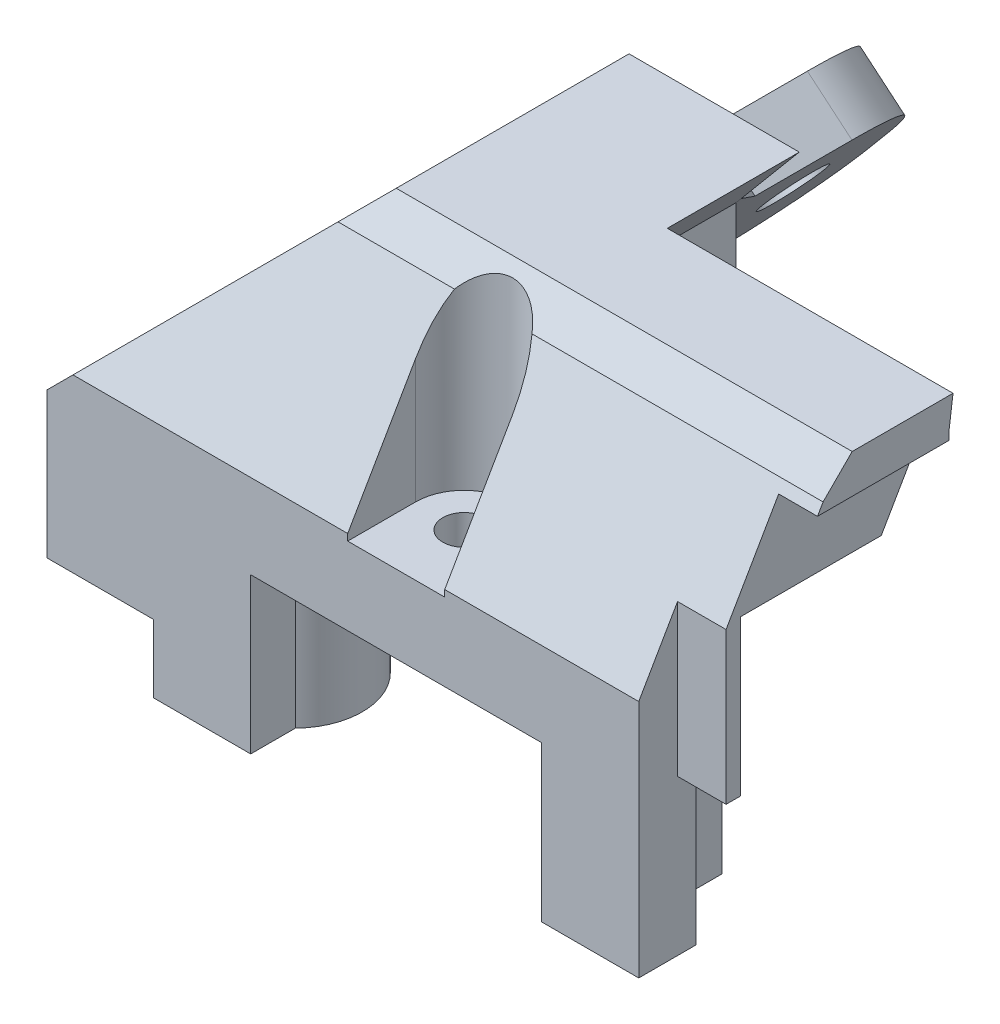
from build123d import *

# Parameters (mm, degrees)
SKETCH_1_W                      = 28
SKETCH_1_H                      = 11.5
SKETCH_1_R                      = 1.1
EXTRUDE_1_DEPTH                 = 3
SKETCH_2_R                      = 3.5
EXTRUDE_2_DEPTH                 = 8
CUT_EXTRUDE_1_DEPTH             = 22.260291625
CUT_EXTRUDE_1_DEPTH_BACK        = 22.260291625
SKETCH_3_W                      = 25.5
SKETCH_3_H                      = 3.95
EXTRUDE_3_DEPTH                 = 3
SKETCH_5_W                      = 3.5
SKETCH_5_H                      = 3
EXTRUDE_4_DEPTH                 = 2
EXTRUDE_5_DEPTH                 = 5
EXTRUDE_6_DEPTH                 = 5
SKETCH_8_W                      = 25.5
SKETCH_8_H                      = 3.95
EXTRUDE_7_DEPTH                 = 3
EXTRUDE_8_DEPTH                 = 4.5
SKETCH_10_W                     = 2.5
SKETCH_10_H                     = 17.5
EXTRUDE_9_DEPTH                 = 7
SKETCH_11_W                     = 25.5
SKETCH_11_H                     = 1.5
CUT_EXTRUDE_2_DEPTH             = 3
CHAMFER_1_SIZE                  = 1.5
CHAMFER_1_SIZE2                 = 2.598076211
EXTRUDE_10_REACH                = 31.245
EXTRUDE_10_DIRECTION_2_REACH    = 31.245
SKETCH_13_W                     = 3.5
SKETCH_13_H                     = 8
CUT_EXTRUDE_3_DEPTH             = 0.3
CHAMFER_2_SIZE                  = 0.75
SKETCH_14_W                     = 2.5
SKETCH_14_H                     = 2
CUT_EXTRUDE_4_DEPTH             = 30.244657632
CUT_EXTRUDE_4_DIRECTION_2_REACH = 31.245
CUT_EXTRUDE_5_REACH             = 29.663
SKETCH_15_W                     = 2.5
SKETCH_15_H                     = 8
SKETCH_16_R                     = 1.1
EXTRUDE_11_DEPTH                = 1
EXTRUDE_12_DEPTH                = 8.5
SKETCH_20_W                     = 7.5
SKETCH_20_H                     = 3
EXTRUDE_14_DEPTH                = 5.598076211
EXTRUDE_15_DEPTH                = 3
CUT_EXTRUDE_6_DEPTH             = 2
SKETCH_24_W                     = 2.5
SKETCH_24_H                     = 10.45
EXTRUDE_16_DEPTH                = 2
CUT_EXTRUDE_7_REACH             = 29.663
SKETCH_25_W                     = 13.241350553
SKETCH_25_H                     = 2
CHAMFER_3_SIZE                  = 1.5
CHAMFER_5_SIZE                  = 5
CHAMFER_5_SIZE2                 = 8.660254038
CHAMFER_6_SIZE                  = 10
CHAMFER_7_SIZE                  = 2
CHAMFER_8_SIZE                  = 2
EXTRUDE_17_DEPTH                = 1.5
EXTRUDE_21_DEPTH                = 2
EXTRUDE_18_DEPTH                = 2
CHAMFER_9_SIZE                  = 1.5
EXTRUDE_19_DEPTH                = 15.984546635
EXTRUDE_20_REACH                = 31.606
CUT_EXTRUDE_8_REACH             = 31.606
EXTRUDE_22_DEPTH                = 12
SKETCH_36_R                     = 1.6
CUT_EXTRUDE_9_DEPTH             = 3
EXTRUDE_23_DEPTH                = 10
FILLET_1_R                      = 5


# Some blends are built 0.0001 mm under size
with BuildPart() as part:
    # 草图1 → 凸台-拉伸1 (new body)
    with BuildSketch(Plane(origin=(0, 0, 0), x_dir=(1, 0, 0), z_dir=(0, 1, 0))):
        with Locations((-4, 2.25)):
            Rectangle(SKETCH_1_W, SKETCH_1_H)
        with Locations(Location((0, 0, 0), (0, 0, 270))):
            Circle(SKETCH_1_R, mode=Mode.SUBTRACT)
    extrude(amount=EXTRUDE_1_DEPTH)

    # 草图2 → 凸台-拉伸2 (add)
    with BuildSketch(Plane.XZ):
        with Locations(Location((-10, -1.25, 0), (0, 0, 90))):
            Circle(SKETCH_2_R)
        with BuildLine():
            Line((10, 2.25), (10, -4.75))
            ThreePointArc((10, -4.75), (6.5, -1.25), (10, 2.25))
        make_face()
    extrude(amount=EXTRUDE_2_DEPTH)

    # 草图3 → 切除-拉伸1 (cut, two sides: drawn at the far end of the back side and taken through both)
    with BuildSketch(Plane.XZ.offset(-CUT_EXTRUDE_1_DEPTH_BACK)):
        with Locations((-2.75, -6.025)):
            Rectangle(SKETCH_3_W, SKETCH_3_H)
    extrude(amount=CUT_EXTRUDE_1_DEPTH + CUT_EXTRUDE_1_DEPTH_BACK, mode=Mode.SUBTRACT)

    # 草图4 → 凸台-拉伸3 (add)
    with BuildSketch(Plane(origin=(10, 0, 0), x_dir=(0, 0, -1), z_dir=(1, 0, 0))):
        Polygon((0, 3), (0, -8), (-2.25, -8), (-2.25, 0), (-3.5, 0), (-3.5, 3), align=None)
    extrude(amount=EXTRUDE_3_DEPTH)

    # 草图5 → 凸台-拉伸4 (add)
    with BuildSketch(Plane(origin=(13, 0, 0), x_dir=(0, 0, -1), z_dir=(1, 0, 0))):
        with Locations((-1.75, 1.5)):
            Rectangle(SKETCH_5_W, SKETCH_5_H)
    extrude(amount=EXTRUDE_4_DEPTH)

    # 草图6 → 凸台-拉伸5 (add)
    with BuildSketch(Plane(origin=(0, 3, 0), x_dir=(1, 0, 0), z_dir=(0, 1, 0))):
        with BuildLine():
            Line((-2.5, 0), (-2.5, -3.5))
            Line((-2.5, -3.5), (-18, -3.5))
            Line((-18, -3.5), (-18, 8))
            Line((-18, 8), (-15.5, 8))
            Line((-15.5, 8), (-15.5, 4.05))
            Line((-15.5, 4.05), (10, 4.05))
            Line((10, 4.05), (10, 0))
            Line((10, 0), (15, 0))
            Line((15, 0), (15, -3.5))
            Line((15, -3.5), (2.5, -3.5))
            Line((2.5, -3.5), (2.5, 0))
            ThreePointArc((2.5, 0), (0, 2.5), (-2.5, 0))
        make_face()
    extrude(amount=EXTRUDE_5_DEPTH)

    # 草图7 → 凸台-拉伸6 (add)
    with BuildSketch(Plane(origin=(0, 8, 0), x_dir=(1, 0, 0), z_dir=(0, 1, 0))):
        with BuildLine():
            Line((10, 0), (10, 4.05))
            Line((10, 4.05), (-15.5, 4.05))
            Line((-15.5, 4.05), (-15.5, 8))
            Line((-15.5, 8), (-18, 8))
            Line((-18, 8), (-18, -3.5))
            Line((-18, -3.5), (-2.5, -3.5))
            Line((-2.5, -3.5), (-2.5, 0))
            ThreePointArc((-2.5, 0), (0, 2.5), (2.5, 0))
            Line((2.5, 0), (2.5, -3.5))
            Line((2.5, -3.5), (15, -3.5))
            Line((15, -3.5), (15, 0))
            Line((15, 0), (10, 0))
        make_face()
        Polygon((10, 0), (15, 0), (15, 8), (-15.5, 8), (-15.5, 4.05), (10, 4.05), align=None)
    extrude(amount=EXTRUDE_6_DEPTH)

    # 草图8 → 凸台-拉伸7 (add)
    with BuildSketch(Plane.XZ.offset(-8)):
        with Locations((-2.75, -6.025)):
            Rectangle(SKETCH_8_W, SKETCH_8_H)
    extrude(amount=EXTRUDE_7_DEPTH)

    # 草图9 → 凸台-拉伸8 (add)
    with BuildSketch(Plane.XZ):
        with BuildLine():
            Line((-12.1, -4.05), (-15.5, -4.05))
            Line((-15.5, -4.05), (-15.5, -8))
            Line((-15.5, -8), (-18, -8))
            Line((-18, -8), (-18, -4.05))
            Line((-18, -4.05), (-18, 3.5))
            Line((-18, 3.5), (-7.5, 3.5))
            Line((-7.5, 3.5), (-7.5, 1.199489743))
            ThreePointArc((-7.5, 1.199489743), (-12.632353631, 1.056667371), (-12.1, -4.05))
        make_face()
    extrude(amount=EXTRUDE_8_DEPTH)

    # 草图10 → 凸台-拉伸9 (add)
    with BuildSketch(Plane(origin=(0, 0, -8), x_dir=(-1, 0, 0), z_dir=(0, 0, -1))):
        with Locations((16.75, 4.25)):
            Rectangle(SKETCH_10_W, SKETCH_10_H)
    extrude(amount=EXTRUDE_9_DEPTH)

    # 草图11 → 切除-拉伸2 (cut)
    with BuildSketch(Plane.XZ.offset(-5)):
        with Locations((-2.75, -7.25)):
            Rectangle(SKETCH_11_W, SKETCH_11_H)
    extrude(amount=-CUT_EXTRUDE_2_DEPTH, mode=Mode.SUBTRACT)

    # 倒角1
    chamfer_1_edges = [part.edges().sort_by_distance(p)[0] for p in [
        (-0.25, 8, -8),
    ]]
    chamfer_1_side = [part.faces().sort_by_distance(p)[0] for p in [
        (-15.184682699, 8, -7.25),
    ]]
    chamfer(chamfer_1_edges, length=CHAMFER_1_SIZE, length2=CHAMFER_1_SIZE2, reference=chamfer_1_side[0])

    # 凸台-拉伸10: up to this face of the body (flat: up to its plane)
    extrude_10_end = Plane(part.part.faces().sort_by_distance((-10, -8, -1.080764101))[0])
    # 草图12 → 凸台-拉伸10 (add, up to the picked face)
    with BuildSketch(Plane.XZ.offset(4.5), mode=Mode.PRIVATE) as extrude_10_sk1:
        with BuildLine():
            Line((-12.5, 3.5), (-12.5, 1.199489743))
            ThreePointArc((-12.5, 1.199489743), (-10, 2.25), (-7.5, 1.199489743))
            Line((-7.5, 1.199489743), (-7.5, 3.5))
            Line((-7.5, 3.5), (-12.5, 3.5))
        make_face()
    extrude_10_tool1 = split(extrude(extrude_10_sk1.sketch, amount=EXTRUDE_10_REACH, mode=Mode.PRIVATE), bisect_by=extrude_10_end, keep=Keep.BOTH, mode=Mode.PRIVATE)
    # 草图12 → 凸台-拉伸10 (add, up to the picked face)
    with BuildSketch(Plane.XZ.offset(4.5), mode=Mode.PRIVATE) as extrude_10_sk2:
        with BuildLine():
            Line((7.5, 3.5), (7.5, 1.199489743))
            ThreePointArc((7.5, 1.199489743), (8.644126499, 1.976702194), (10, 2.25))
            Line((10, 2.25), (12.5, 2.25))
            Line((12.5, 2.25), (13, 2.25))
            Line((13, 2.25), (13, 3.5))
            Line((13, 3.5), (12.5, 3.5))
            Line((12.5, 3.5), (7.5, 3.5))
        make_face()
    extrude_10_tool2 = split(extrude(extrude_10_sk2.sketch, amount=EXTRUDE_10_REACH, mode=Mode.PRIVATE), bisect_by=extrude_10_end, keep=Keep.BOTH, mode=Mode.PRIVATE)
    add(extrude_10_tool1.solids().sort_by(Axis((-10, -4.5, 2.682619), (0, -1, 0)))[0])
    add(extrude_10_tool2.solids().sort_by(Axis((10.022618, -4.5, 2.776432), (0, -1, 0)))[0])

    # 凸台-拉伸10 direction 2: up to this face of the body (flat: up to its plane)
    extrude_10_direction_2_end = Plane(part.part.faces().sort_by_distance((1.489654817, 0, 0.088188875))[0])
    # 草图12 → 凸台-拉伸10 direction 2 (add, up to the picked face)
    with BuildSketch(Plane.XZ.offset(4.5), mode=Mode.PRIVATE) as extrude_10_direction_2_sk1:
        with BuildLine():
            Line((-12.5, 3.5), (-12.5, 1.199489743))
            ThreePointArc((-12.5, 1.199489743), (-10, 2.25), (-7.5, 1.199489743))
            Line((-7.5, 1.199489743), (-7.5, 3.5))
            Line((-7.5, 3.5), (-12.5, 3.5))
        make_face()
    extrude_10_direction_2_tool1 = split(extrude(extrude_10_direction_2_sk1.sketch, amount=-EXTRUDE_10_DIRECTION_2_REACH, mode=Mode.PRIVATE), bisect_by=extrude_10_direction_2_end, keep=Keep.BOTH, mode=Mode.PRIVATE)
    # 草图12 → 凸台-拉伸10 direction 2 (add, up to the picked face)
    with BuildSketch(Plane.XZ.offset(4.5), mode=Mode.PRIVATE) as extrude_10_direction_2_sk2:
        with BuildLine():
            Line((7.5, 3.5), (7.5, 1.199489743))
            ThreePointArc((7.5, 1.199489743), (8.644126499, 1.976702194), (10, 2.25))
            Line((10, 2.25), (12.5, 2.25))
            Line((12.5, 2.25), (13, 2.25))
            Line((13, 2.25), (13, 3.5))
            Line((13, 3.5), (12.5, 3.5))
            Line((12.5, 3.5), (7.5, 3.5))
        make_face()
    extrude_10_direction_2_tool2 = split(extrude(extrude_10_direction_2_sk2.sketch, amount=-EXTRUDE_10_DIRECTION_2_REACH, mode=Mode.PRIVATE), bisect_by=extrude_10_direction_2_end, keep=Keep.BOTH, mode=Mode.PRIVATE)
    add(extrude_10_direction_2_tool1.solids().sort_by(Axis((-10, -4.5, 2.682619), (0, 1, 0)))[0])
    add(extrude_10_direction_2_tool2.solids().sort_by(Axis((10.022618, -4.5, 2.776432), (0, 1, 0)))[0])

    # 草图13 → 切除-拉伸3 (cut)
    with BuildSketch(Plane(origin=(13, 0, 0), x_dir=(0, 0, -1), z_dir=(1, 0, 0))):
        with Locations((-1.75, -4)):
            Rectangle(SKETCH_13_W, SKETCH_13_H)
    extrude(amount=-CUT_EXTRUDE_3_DEPTH, mode=Mode.SUBTRACT)

    # 倒角2
    chamfer_2_edges = [part.edges().sort_by_distance(p)[0] for p in [
        (10, -1.5, -4.05),
        (10, 6.5, -6.5),
        (12.7, -4, 0),
        (15, 4, 0),
    ]]
    chamfer(chamfer_2_edges, length=CHAMFER_2_SIZE)

    # 草图14 → 切除-拉伸4 (cut)
    with BuildSketch(Plane.XZ.offset(4.5)):
        with Locations((13.75, 2.5)):
            Rectangle(SKETCH_14_W, SKETCH_14_H)
    extrude(amount=-CUT_EXTRUDE_4_DEPTH, mode=Mode.SUBTRACT)

    # 草图14 → 切除-拉伸4 direction 2 (cut, up to next)
    with BuildSketch(Plane.XZ.offset(4.5), mode=Mode.PRIVATE) as cut_extrude_4_direction_2_sk1:
        with Locations((13.75, 2.5)):
            Rectangle(SKETCH_14_W, SKETCH_14_H)
    cut_extrude_4_direction_2_tool1 = extrude(cut_extrude_4_direction_2_sk1.sketch, amount=CUT_EXTRUDE_4_DIRECTION_2_REACH, mode=Mode.PRIVATE) & part.part
    add(cut_extrude_4_direction_2_tool1.solids().sort_by_distance((13.75, -4.5, 2.5))[0], mode=Mode.SUBTRACT)

    # 草图15 → 切除-拉伸5 (cut, up to next)
    with BuildSketch(Plane.XY.offset(1.5), mode=Mode.PRIVATE) as cut_extrude_5_sk1:
        with Locations((13.75, -4)):
            Rectangle(SKETCH_15_W, SKETCH_15_H)
    cut_extrude_5_tool1 = extrude(cut_extrude_5_sk1.sketch, amount=-CUT_EXTRUDE_5_REACH, mode=Mode.PRIVATE) & part.part
    add(cut_extrude_5_tool1.solids().sort_by_distance((13.75, -4, 1.5))[0], mode=Mode.SUBTRACT)

    # 草图16 → 凸台-拉伸11 (add)
    with BuildSketch(Plane(origin=(0, 3, 0), x_dir=(1, 0, 0), z_dir=(0, 1, 0))):
        with BuildLine():
            Line((2.5, -3.5), (2.5, 0))
            ThreePointArc((2.5, 0), (0, 2.5), (-2.5, 0))
            Line((-2.5, 0), (-2.5, -3.5))
            Line((-2.5, -3.5), (2.5, -3.5))
        make_face()
        with Locations(Location((0, 0, 0), (0, 0, 270))):
            Circle(SKETCH_16_R, mode=Mode.SUBTRACT)
    extrude(amount=EXTRUDE_11_DEPTH)

    # 草图18 → 凸台-拉伸12 (add)
    with BuildSketch(Plane(origin=(0, 0, -6.5), x_dir=(-1, 0, 0), z_dir=(0, 0, -1))):
        Polygon((15.5, 5), (8.5, 5), (8.5, 10.598076211), (1, 10.598076211), (-1.015453365, 13), (1, 13), (15.5, 13), align=None)
    extrude(amount=EXTRUDE_12_DEPTH)

    # 草图20 → 凸台-拉伸14 (add)
    with BuildSketch(Plane.XZ.offset(-10.598076211)):
        with Locations((-4.75, -13.5)):
            Rectangle(SKETCH_20_W, SKETCH_20_H)
    extrude(amount=EXTRUDE_14_DEPTH)

    # 草图21 → 凸台-拉伸15 (add)
    with BuildSketch(Plane.XY.offset(-12)):
        Polygon((-1, 5), (-3.936848709, 1.5), (-8.5, 1.5), (-10.38797417, -0.75), (-15.5, -0.75), (-15.5, 1.5), (-15.5, 5), align=None)
    extrude(amount=-EXTRUDE_15_DEPTH)

    # 草图23 → 切除-拉伸6 (cut)
    with BuildSketch(Plane(origin=(0, 0, -15), x_dir=(-1, 0, 0), z_dir=(0, 0, -1))):
        Polygon((8.5, 1.5), (15.5, 1.5), (15.5, -0.75), (10.38797417, -0.75), align=None)
    extrude(amount=-CUT_EXTRUDE_6_DEPTH, mode=Mode.SUBTRACT)

    # 草图24 → 凸台-拉伸16 (add)
    with BuildSketch(Plane.XZ.offset(4.5)):
        with Locations((-16.75, -9.775)):
            Rectangle(SKETCH_24_W, SKETCH_24_H)
    extrude(amount=EXTRUDE_16_DEPTH)

    # 草图25 → 切除-拉伸7 (cut, up to next)
    with BuildSketch(Plane(origin=(0, 0, -13), x_dir=(-1, 0, 0), z_dir=(0, 0, -1)), mode=Mode.PRIVATE) as cut_extrude_7_sk1:
        with Locations((8.879324724, 2.5)):
            Rectangle(SKETCH_25_W, SKETCH_25_H)
    cut_extrude_7_tool1 = extrude(cut_extrude_7_sk1.sketch, amount=CUT_EXTRUDE_7_REACH, mode=Mode.PRIVATE) & part.part
    add(cut_extrude_7_tool1.solids().sort_by_distance((-8.879325, 2.5, -13))[0], mode=Mode.SUBTRACT)

    # 倒角3
    chamfer_3_edges = [part.edges().sort_by_distance(p)[0] for p in [
        (-4.75, 10.598076211, -12),
    ]]
    chamfer(chamfer_3_edges, length=CHAMFER_3_SIZE)

    # 倒角5
    chamfer_5_edges = [part.edges().sort_by_distance(p)[0] for p in [
        (-10.25, 13, 3.5),
        (7.5, 13, 3.5),
    ]]
    chamfer_5_side = [part.faces().sort_by_distance(p)[0] for p in [
        (-3.681918062, 13, -5.033050498),
    ]]
    chamfer(chamfer_5_edges, length=CHAMFER_5_SIZE, length2=CHAMFER_5_SIZE2, reference=chamfer_5_side[0])

    # 倒角6
    chamfer_6_edges = [part.edges().sort_by_distance(p)[0] for p in [
        (-18, 13, -8.25),
    ]]
    chamfer(chamfer_6_edges, length=CHAMFER_6_SIZE)

    # 倒角7
    chamfer_7_edges = [part.edges().sort_by_distance(p)[0] for p in [
        (-15.5, 3.5, -14),
    ]]
    chamfer(chamfer_7_edges, length=CHAMFER_7_SIZE)

    # 倒角8
    chamfer_8_edges = [part.edges().sort_by_distance(p)[0] for p in [
        (-15.5, 5, -8.025),
        (-8.5, 10.598076211, -9.25),
    ]]
    chamfer(chamfer_8_edges, length=CHAMFER_8_SIZE)

    # 草图28 → 凸台-拉伸17 (add)
    with BuildSketch(Plane(origin=(0, 13, 0), x_dir=(1, 0, 0), z_dir=(0, 1, 0))):
        with BuildLine():
            Line((1.015453365, 15), (-8, 15))
            Line((-8, 15), (-8, 1.5))
            Line((-8, 1.5), (-2, 1.5))
            ThreePointArc((-2, 1.5), (0, 2.5), (2, 1.5))
            Line((2, 1.5), (15, 1.5))
            Line((15, 1.5), (15, 8))
            Line((15, 8), (1.015453365, 8))
            Line((1.015453365, 8), (1.015453365, 15))
        make_face()
    extrude(amount=EXTRUDE_17_DEPTH)

    # 草图34 → 凸台-拉伸21 (add)
    with BuildSketch(Plane(origin=(0, 0, -13), x_dir=(-1, 0, 0), z_dir=(0, 0, -1))):
        Polygon((2.258649447, 3.5), (3.097749078, 2.5), (14.5, 2.5), (13.5, 3.5), align=None)
    extrude(amount=EXTRUDE_21_DEPTH)

    # 草图29 → 凸台-拉伸18 (add)
    with BuildSketch(Plane(origin=(15, 0, 0), x_dir=(0, 0, -1), z_dir=(1, 0, 0))):
        Polygon((1.5, 14.5), (1.5, 13), (1.211324865, 12.5), (8, 12.5), (8, 14.5), align=None)
    extrude(amount=EXTRUDE_18_DEPTH)

    # 倒角9
    chamfer_9_edges = [part.edges().sort_by_distance(p)[0] for p in [
        (-5, 14.5, -1.5),
        (-8, 14.5, -8.25),
    ]]
    chamfer(chamfer_9_edges, length=CHAMFER_9_SIZE - 0.0001)  # a hair under: the kernel refuses the full size

    # 草图30 → 凸台-拉伸19 (add)
    with BuildSketch(Plane(origin=(1.015453365, 0, 0), x_dir=(0, 0, -1), z_dir=(1, 0, 0))):
        Polygon((8, 13), (8.197478746, 14.5), (8, 14.5), align=None)
    extrude(amount=EXTRUDE_19_DEPTH)

    # 凸台-拉伸20: up to this face of the body (flat: up to its plane)
    extrude_20_end = Plane(part.part.faces().sort_by_distance((9.007726683, 13.75, -8.098739373))[0])
    # 草图32 → 凸台-拉伸20 (add, up to the picked face)
    with BuildSketch(Plane(origin=(0, 0, -15), x_dir=(-1, 0, 0), z_dir=(0, 0, -1)), mode=Mode.PRIVATE) as extrude_20_sk1:
        Polygon((-1.015453365, 13), (-2.274102812, 14.5), (-1.015453365, 14.5), align=None)
    extrude_20_tool1 = split(extrude(extrude_20_sk1.sketch, amount=-EXTRUDE_20_REACH, mode=Mode.PRIVATE), bisect_by=extrude_20_end, keep=Keep.BOTH, mode=Mode.PRIVATE)
    add(extrude_20_tool1.solids().sort_by(Axis((1.435003, 14, -15), (0, 0, 1)))[0])

    # 切除-拉伸8: up to this face of the body (flat: up to its plane)
    cut_extrude_8_end = Plane(part.part.faces().sort_by_distance((-7.893394404, 4.143694153, -12))[0])
    # 草图33 → 切除-拉伸8 (cut, up to the picked face)
    with BuildSketch(Plane(origin=(0, 0, -15), x_dir=(-1, 0, 0), z_dir=(0, 0, -1)), mode=Mode.PRIVATE) as cut_extrude_8_sk1:
        Polygon((1, 5), (1, 5.777861913), (4.589552354, 1.5), (3.936848709, 1.5), align=None)
    cut_extrude_8_tool1 = split(extrude(cut_extrude_8_sk1.sketch, amount=-CUT_EXTRUDE_8_REACH, mode=Mode.PRIVATE), bisect_by=cut_extrude_8_end, keep=Keep.BOTH, mode=Mode.PRIVATE)
    add(cut_extrude_8_tool1.solids().sort_by(Axis((-2.63704, 3.450948, -15), (0, 0, 1)))[0], mode=Mode.SUBTRACT)

    # 草图35 → 凸台-拉伸22 (add)
    with BuildSketch(Plane(origin=(0, 0, -15), x_dir=(-1, 0, 0), z_dir=(0, 0, -1))):
        Polygon((2.010004275, 9.394399988), (7.795092762, 2.5), (11.71131463, 2.5), (4.308137604, 11.322762817), align=None)
    extrude(amount=EXTRUDE_22_DEPTH)

    # 草图36 → 切除-拉伸9 (cut)
    with BuildSketch(Plane(origin=(-8.103491228, 6.799636501, 0), x_dir=(0, 0, 1), z_dir=(-0.7660444431189746, 0.6427876096865437, 0))):
        with Locations(Location((-22.127, 0.974522064, 0), (0, 0, 270))):
            Circle(SKETCH_36_R)
    extrude(amount=-CUT_EXTRUDE_9_DEPTH, mode=Mode.SUBTRACT)

    # 草图37 → 凸台-拉伸23 (add)
    with BuildSketch(Plane(origin=(0, 0, -27), x_dir=(-1, 0, 0), z_dir=(0, 0, -1))):
        Polygon((11.71131463, 2.5), (7.795092762, 2.5), (9.413181301, 0.571637171), align=None)
    extrude(amount=-EXTRUDE_23_DEPTH)

    # 圆角1
    fillet_1_edges = [part.edges().sort_by_distance(p)[0] for p in [
        (-3.15907094, 10.358581403, -27),
        (-10.562247966, 1.535818585, -27),
    ]]
    fillet(fillet_1_edges, radius=FILLET_1_R)

    # 倒角10
    # the kernel refuses this chamfer: 2 mm, written as the material it adds along each edge
    with BuildSketch(Plane(origin=(-4.308137604, 11.322762817, -15), x_dir=(-0.017674008802754975, -0.021063063486224685, -0.9996219169112968), z_dir=(0.7660444431189742, -0.6427876096865438, 0))) as chamfer_10_piece_1:
        with BuildLine():
            Line((2.05734639, 0), (-0.11309431, 2.054235587))
            Line((-0.11309431, 2.054235587), (-0.153079186, 2.053135752))
            ThreePointArc((-0.153079186, 2.053135752), (-0.068258454, 1.026795659), (-0.039984877, -0.001099835))
            Line((-0.039984877, -0.001099835), (0.001099835, -0.039984877))
            ThreePointArc((0.001099835, -0.039984877), (1.028995329, -0.011711299), (2.058446225, -0.039984877))
            Line((2.058446225, -0.039984877), (2.05734639, 0))
        make_face()
    extrude(amount=3)
    with BuildSketch(Plane(origin=(-15.017406552, -1.440046925, -15), x_dir=(-0.765754814669836, 0.642544582561693, 0.02749587661058647), z_dir=(0.6427876096865436, 0.7660444431189746, 0))) as chamfer_10_piece_2_section:
        with BuildLine():
            Line((2.05734639, 0), (-0.11309431, -2.054235587))
            Line((-0.11309431, -2.054235587), (-0.153079186, -2.053135752))
            ThreePointArc((-0.153079186, -2.053135752), (-0.068258454, -1.026795659), (-0.039984877, 0.001099835))
            Line((-0.039984877, 0.001099835), (0.001099835, 0.039984877))
            ThreePointArc((0.001099835, 0.039984877), (1.028995329, 0.011711299), (2.058446225, 0.039984877))
            Line((2.058446225, 0.039984877), (2.05734639, 0))
        make_face()
    chamfer_10_piece_2 = extrude(amount=16.660664869, mode=Mode.PRIVATE)
    chamfer_10_piece_2 = split(chamfer_10_piece_2, bisect_by=Plane(origin=(-8.711166063, 2.5, -15.650147459), z_dir=(0, 1, 0)), keep=Keep.TOP, mode=Mode.PRIVATE)
    add(chamfer_10_piece_2)
    with BuildSketch(Plane(origin=(-8.248184529, 14.628854739, -15), x_dir=(-0.017674008802755155, -0.0210630634862249, -0.9996219169112968), z_dir=(0.7660444431189742, -0.6427876096865438, 0))) as chamfer_10_piece_3a_section:
        with BuildLine():
            Line((2.05734639, 0), (-0.11309431, 2.054235587))
            Line((-0.11309431, 2.054235587), (-0.153079186, 2.053135752))
            ThreePointArc((-0.153079186, 2.053135752), (-0.068258454, 1.026795659), (-0.039984877, -0.001099835))
            Line((-0.039984877, -0.001099835), (0.001099835, -0.039984877))
            ThreePointArc((0.001099835, -0.039984877), (1.028995329, -0.011711299), (2.058446225, -0.039984877))
            Line((2.058446225, -0.039984877), (2.05734639, 0))
        make_face()
    chamfer_10_piece_3a = extrude(amount=8.143365976, mode=Mode.PRIVATE)
    chamfer_10_piece_3a = split(chamfer_10_piece_3a, bisect_by=Plane(origin=(-3.88416309, 11.828035968, -15.659587254), z_dir=(-0.7660444431189746, 0.6427876096865436, 0)), keep=Keep.TOP, mode=Mode.PRIVATE)
    with BuildSketch(Plane(origin=(-15.017406552, -1.440046925, -15), x_dir=(-0.765754814669836, 0.642544582561693, 0.02749587661058647), z_dir=(0.6427876096865436, 0.7660444431189746, 0))) as chamfer_10_piece_3b_section:
        with BuildLine():
            Line((2.05734639, 0), (-0.11309431, -2.054235587))
            Line((-0.11309431, -2.054235587), (-0.153079186, -2.053135752))
            ThreePointArc((-0.153079186, -2.053135752), (-0.068258454, -1.026795659), (-0.039984877, 0.001099835))
            Line((-0.039984877, 0.001099835), (0.001099835, 0.039984877))
            ThreePointArc((0.001099835, 0.039984877), (1.028995329, 0.011711299), (2.058446225, 0.039984877))
            Line((2.058446225, 0.039984877), (2.05734639, 0))
        make_face()
    chamfer_10_piece_3b = extrude(amount=21.804030845, mode=Mode.PRIVATE)
    chamfer_10_piece_3b = split(chamfer_10_piece_3b, bisect_by=Plane(origin=(-4.813410755, 11.746737331, -15.659587254), z_dir=(0.6427876096865439, 0.7660444431189745, 0)), keep=Keep.TOP, mode=Mode.PRIVATE)
    chamfer_10_piece_3 = chamfer_10_piece_3a & chamfer_10_piece_3b
    add(chamfer_10_piece_3)


solid = part.part
